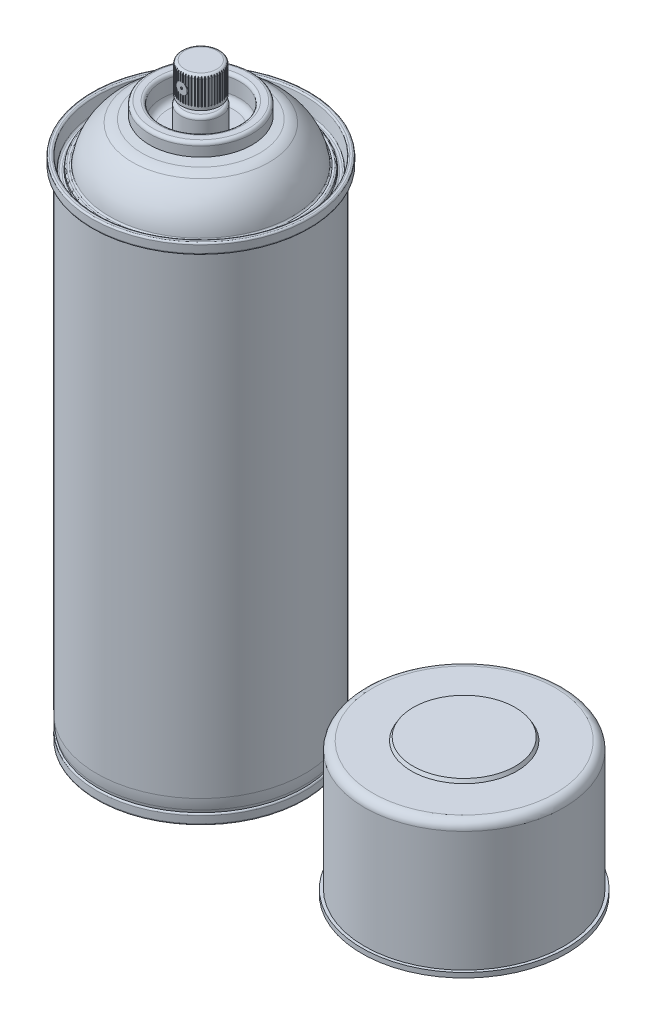
from build123d import *

# Parameters (mm, degrees)
SKETCH1_R            = 32.5
BOSS_EXTRUDE1_DEPTH  = 158
CHAMFER1_SIZE        = 1
CHAMFER1_SIZE2       = 5.67128182
FILLET1_R            = 19
MOVE_FACE1_OUTLINE_W = 66
MOVE_FACE1_OUTLINE_H = 66
MOVE_FACE1_DEPTH     = 2.5
DOME1_FACE_RADIUS    = 31.940817452
DOME1_HEIGHT         = 6
SKETCH2_R            = 32.5
SKETCH2_R_2          = 31
EXTRUDE_THIN1_DEPTH  = 3.2
FILLET2_R            = 0.5
CUT_EXTRUDE1_START   = -3.9
SKETCH3_R            = 32.5
CUT_EXTRUDE1_DEPTH   = 3.9
FILLET4_R            = 0.5
FILLET6_R            = 0.5
FILLET7_R            = 6.5
FILLET8_R            = 1
SKETCH7_R            = 0.347497099
CUT_EXTRUDE2_DEPTH   = 12.9
SKETCH8_R            = 1.75
SKETCH8_R_2          = 0.347497099
BOSS_EXTRUDE2_DEPTH  = 6
CUT_EXTRUDE3_DEPTH   = 8.5
CIRPATTERN1_COUNT    = 50


with BuildPart() as part:
    # Sketch1 → Boss-Extrude1 (new body)
    with BuildSketch(Plane(origin=(0, 0, 0), x_dir=(1, 0, 0), z_dir=(0, 1, 0))):
        with Locations(Location((0, 0, 0), (0, 0, 270))):
            Circle(SKETCH1_R)
    extrude(amount=BOSS_EXTRUDE1_DEPTH)

    # Chamfer1
    chamfer1_edges = [part.edges().sort_by_distance(p)[0] for p in [
        (0, 0, -32.5),
    ]]
    chamfer1_side = [part.faces().sort_by_distance(p)[0] for p in [
        (0, 0, 0),
    ]]
    chamfer(chamfer1_edges, length=CHAMFER1_SIZE, length2=CHAMFER1_SIZE2, reference=chamfer1_side[0])

    # Fillet1
    fillet1_edges = [part.edges().sort_by_distance(p)[0] for p in [
        (0, 5.67128182, -32.5),
    ]]
    fillet(fillet1_edges, radius=FILLET1_R)

    # Move Face1: read off the stored shape, not the designer's step
    # Move Face1 outline → Move Face1 (cut)
    with BuildSketch(Plane(origin=(0, 0, 0), x_dir=(1, 0, 0), z_dir=(0, 1, 0))):
        Rectangle(MOVE_FACE1_OUTLINE_W, MOVE_FACE1_OUTLINE_H)
    extrude(amount=MOVE_FACE1_DEPTH, mode=Mode.SUBTRACT)

    # Dome1: a dome of height H over a round flat face of radius A is a cap of a sphere of radius (A * A + H * H) / (2 * H)
    dome1_r = (DOME1_FACE_RADIUS * DOME1_FACE_RADIUS + DOME1_HEIGHT * DOME1_HEIGHT) / (2 * DOME1_HEIGHT)
    dome1_base = Plane((0, 2.5, 0), z_dir=(0, 1, 0))
    with Locations(dome1_base.offset(DOME1_HEIGHT - dome1_r)):
        dome1_ball = Sphere(dome1_r, mode=Mode.PRIVATE)
    add(split(dome1_ball, bisect_by=dome1_base, keep=Keep.TOP, mode=Mode.PRIVATE), mode=Mode.SUBTRACT)


with BuildPart() as body_2:
    # Sketch2 → Extrude-Thin1 (new body)
    with BuildSketch(Plane.XZ):
        Circle(SKETCH2_R)
        Circle(SKETCH2_R_2, mode=Mode.SUBTRACT)
    extrude(amount=-EXTRUDE_THIN1_DEPTH)


with BuildPart() as part_1:
    add(part.part)

    # Combine1: union body 2
    add(body_2.part)

    # Fillet2
    # the kernel refuses this fillet: 0.5 mm, written as the material it adds along each edge
    with BuildSketch(Plane(origin=(0, 2.860201937, 0), x_dir=(0, 0, 1), z_dir=(1, 0, 0))) as fillet2_piece_1:
        with BuildLine():
            CenterArc((30.5, 0.34680454), FILLET2_R, 290.395583427, 69.604416573)
            ThreePointArc((30.674249899, -0.121849888), (30.837185134, -0.06108584), (31, 0))
            Line((31, 0), (31, 0.34680454))
        make_face()
    revolve(axis=Axis((0, 2.860201937, 0), (0, -1, 0)), revolution_arc=270)
    with BuildSketch(Plane(origin=(0, 2.860201937, 0), x_dir=(1, 0, 0), z_dir=(0, 0, -1))) as fillet2_piece_2:
        with BuildLine():
            CenterArc((30.5, 0.34680454), FILLET2_R, 290.395583427, 69.604416573)
            ThreePointArc((30.674249899, -0.121849888), (30.837185134, -0.06108584), (31, 0))
            Line((31, 0), (31, 0.34680454))
        make_face()
    revolve(axis=Axis((0, 2.860201937, 0), (0, -1, 0)), revolution_arc=90)
    # the kernel refuses this fillet: 0.5 mm, written as the material it takes off along each edge
    with BuildSketch(Plane(origin=(0, 0, 0), x_dir=(1, 0, 0), z_dir=(0, 0, -1))) as fillet2_2_piece_1:
        with BuildLine():
            CenterArc((31 + FILLET2_R, -FILLET2_R), FILLET2_R, 90, 90)
            Line((31, -FILLET2_R), (31, 0))
            Line((31, 0), (31 + FILLET2_R, 0))
        make_face()
    revolve(axis=Axis((0, 0, 0), (0, -1, 0)), mode=Mode.SUBTRACT)
    with BuildSketch(Plane(origin=(0, 3.2, 0), x_dir=(1, 0, 0), z_dir=(0, 0, -1))) as fillet2_2_piece_2:
        with BuildLine():
            CenterArc((32, 0.495855229), FILLET2_R, 277.382498537, 82.617501463)
            Line((32.5, 0.495855229), (32.5, 0))
            Line((32.5, 0), (32.064246338, 0))
        make_face()
    revolve(axis=Axis((0, 3.2, 0), (0, -1, 0)), mode=Mode.SUBTRACT)
    with BuildSketch(Plane(origin=(0, 0, 0), x_dir=(1, 0, 0), z_dir=(0, 0, -1))) as fillet2_2_piece_3:
        with BuildLine():
            CenterArc((32.5 - FILLET2_R, -FILLET2_R), FILLET2_R, 0, 90)
            Line((32.5 - FILLET2_R, 0), (32.5, 0))
            Line((32.5, 0), (32.5, -FILLET2_R))
        make_face()
    revolve(axis=Axis((0, 0, 0), (0, -1, 0)), mode=Mode.SUBTRACT)

    # Sketch3 → Cut-Extrude1 (cut)
    with BuildSketch(Plane(origin=(0, 158, 0), x_dir=(1, 0, 0), z_dir=(0, 1, 0)).offset(CUT_EXTRUDE1_START)):
        with Locations(Location((0, 0, 0), (0, 0, 90))):
            Circle(SKETCH3_R)
    extrude(amount=CUT_EXTRUDE1_DEPTH, mode=Mode.SUBTRACT)

    # Sketch4 → Revolve1 (revolve)
    with BuildSketch(Plane.XY, mode=Mode.PRIVATE) as revolve1_sk:
        with BuildLine():
            Line((-12.8, 168.6), (-19.8, 167.987579355))
            ThreePointArc((-19.8, 167.987579355), (-25.75033894, 162.900791806), (-28.575295592, 155.6))
            Line((-28.575295592, 155.6), (-30.075295592, 155.6))
            Line((-30.075295592, 155.6), (-30.206528587, 154.1))
            Line((-30.206528587, 154.1), (-31.706528587, 154.1))
            Line((-31.706528587, 154.1), (-32.5, 158.6))
            Line((-32.5, 158.6), (-34, 158.6))
            Line((-34, 158.6), (-34, 155.3))
            Line((-34, 155.3), (-32.5, 155.3))
            Line((-32.5, 155.3), (-32.5, 153.1))
            Line((-32.5, 153.1), (0, 153.1))
            Line((0, 153.1), (0, 173.1))
            Line((0, 173.1), (-5.25, 173.1))
            ThreePointArc((-5.25, 173.1), (-5.957106781, 172.807106781), (-6.25, 172.1))
            Line((-6.25, 172.1), (-6.25, 165.6))
            Line((-6.25, 165.6), (-10.2, 165.6))
            ThreePointArc((-10.2, 165.6), (-11.614213562, 166.185786438), (-12.2, 167.6))
            Line((-12.2, 167.6), (-12.2, 170.1))
            Line((-12.2, 170.1), (-12.2, 172.1))
            ThreePointArc((-12.2, 172.1), (-12.492893219, 172.807106781), (-13.2, 173.1))
            Line((-13.2, 173.1), (-15, 173.1))
            ThreePointArc((-15, 173.1), (-15.707106781, 172.807106781), (-16, 172.1))
            Line((-16, 172.1), (-16, 169.1))
            Line((-16, 169.1), (-15.5, 169.1))
            Line((-15.5, 169.1), (-15.5, 171.6))
            ThreePointArc((-15.5, 171.6), (-15.207106781, 172.307106781), (-14.5, 172.6))
            Line((-14.5, 172.6), (-13.8, 172.6))
            ThreePointArc((-13.8, 172.6), (-13.092893219, 172.307106781), (-12.8, 171.6))
            Line((-12.8, 171.6), (-12.8, 168.6))
        make_face()
    revolve(revolve1_sk.sketch.rotate(Axis((0, 146.930165076, 0), (0, 1, 0)), 270), axis=Axis((0, 146.930165076, 0), (0, 1, 0)))

    # Fillet4
    fillet4_edges = [part_1.edges().sort_by_distance(p)[0] for p in [
        (0, 158.6, 34),
        (0, 158.6, 32.5),
        (0, 154.1, 31.706528587),
        (0, 155.3, 34),
    ]]
    fillet(fillet4_edges, radius=FILLET4_R)

    # Fillet6
    fillet6_edges = [part_1.edges().sort_by_distance(p)[0] for p in [
        (0, 154.1, 30.206528587),
        (0, 155.6, 30.075295592),
        (0, 155.6, 28.575295592),
    ]]
    fillet(fillet6_edges, radius=FILLET6_R)

    # Fillet7
    fillet7_edges = [part_1.edges().sort_by_distance(p)[0] for p in [
        (0, 167.987579355, 19.8),
    ]]
    fillet(fillet7_edges, radius=FILLET7_R)


with BuildPart() as body_2_2:
    # Sketch5 → Revolve2 (revolve)
    with BuildSketch(Plane.XY, mode=Mode.PRIVATE) as revolve2_sk:
        with BuildLine():
            Line((-30.5, 157.1), (-30.5, 196.1))
            ThreePointArc((-30.5, 196.1), (-29.914213562, 197.514213562), (-28.5, 198.1))
            Line((-28.5, 198.1), (0, 198.1))
            Line((0, 198.1), (0, 199.7))
            Line((0, 199.7), (-15.922649731, 199.7))
            Line((-15.922649731, 199.7), (-16.5, 198.7))
            Line((-16.5, 198.7), (-28.5, 198.7))
            ThreePointArc((-28.5, 198.7), (-30.338477631, 197.938477631), (-31.1, 196.1))
            Line((-31.1, 196.1), (-31.1, 158.6))
            Line((-31.1, 158.6), (-32, 158.6))
            Line((-32, 158.6), (-32, 157.1))
            Line((-32, 157.1), (-30.5, 157.1))
        make_face()
    revolve(revolve2_sk.sketch.rotate(Axis((0, 172.1, 0), (0, 1, 0)), 270), axis=Axis((0, 172.1, 0), (0, 1, 0)))


with BuildPart() as body_3:
    # Sketch6 → Revolve3 (revolve)
    with BuildSketch(Plane.XY, mode=Mode.PRIVATE) as revolve3_sk:
        Polygon((0, 172.1), (0, 184.1), (-6, 184.1), (-6, 174.6), (-3, 174.6), (-3, 172.1), align=None)
    revolve(revolve3_sk.sketch.rotate(Axis((0, 172.1, 0), (0, 1, 0)), 270), axis=Axis((0, 172.1, 0), (0, 1, 0)))

    # Fillet8
    fillet8_edges = [body_3.edges().sort_by_distance(p)[0] for p in [
        (0, 184.1, 6),
    ]]
    fillet(fillet8_edges, radius=FILLET8_R)

    # Sketch7 → Cut-Extrude2 (cut)
    with BuildSketch(Plane.XY):
        with Locations(Location((0, 179.420360953, 0), (0, 0, 180))):
            Circle(SKETCH7_R)
    extrude(amount=CUT_EXTRUDE2_DEPTH, mode=Mode.SUBTRACT)

    # Sketch9 → Cut-Extrude3 (cut)
    with BuildSketch(Plane(origin=(0, 184.1, 0), x_dir=(1, 0, 0), z_dir=(0, 1, 0))):
        with BuildLine():
            Line((5.862338102, -0.096623494), (7, -0.4))
            Line((7, -0.4), (7, 0.4))
            Line((7, 0.4), (5.862338102, 0.096623494))
            ThreePointArc((5.862338102, 0.096623494), (5.788104367, 0), (5.862338102, -0.096623494))
        make_face()
    cut_extrude3 = extrude(amount=-CUT_EXTRUDE3_DEPTH, mode=Mode.SUBTRACT)

    # CirPattern1: Cut-Extrude3 ×50 about axis
    cirpattern1_axis = Axis((0, 0, 0), (0, 1, 0))
    for i in range(1, CIRPATTERN1_COUNT):
        add(cut_extrude3.rotate(cirpattern1_axis, i * 360 / CIRPATTERN1_COUNT), mode=Mode.SUBTRACT)


with BuildPart() as body_4:
    # Sketch8 → Boss-Extrude2 (new body)
    with BuildSketch(Plane.XY):
        with Locations((0, 179.420360953)):
            Circle(SKETCH8_R)
        with Locations((0, 179.420360953)):
            Circle(SKETCH8_R_2, mode=Mode.SUBTRACT)
    extrude(amount=BOSS_EXTRUDE2_DEPTH)


with BuildPart() as body_2_2_1:
    # Body-Move/Copy1: moved
    add(body_2_2.part.moved(Location((82.239572983, -157.541076882, 0))))


solid = Compound([part_1.part, body_3.part, body_4.part, body_2_2_1.part])
